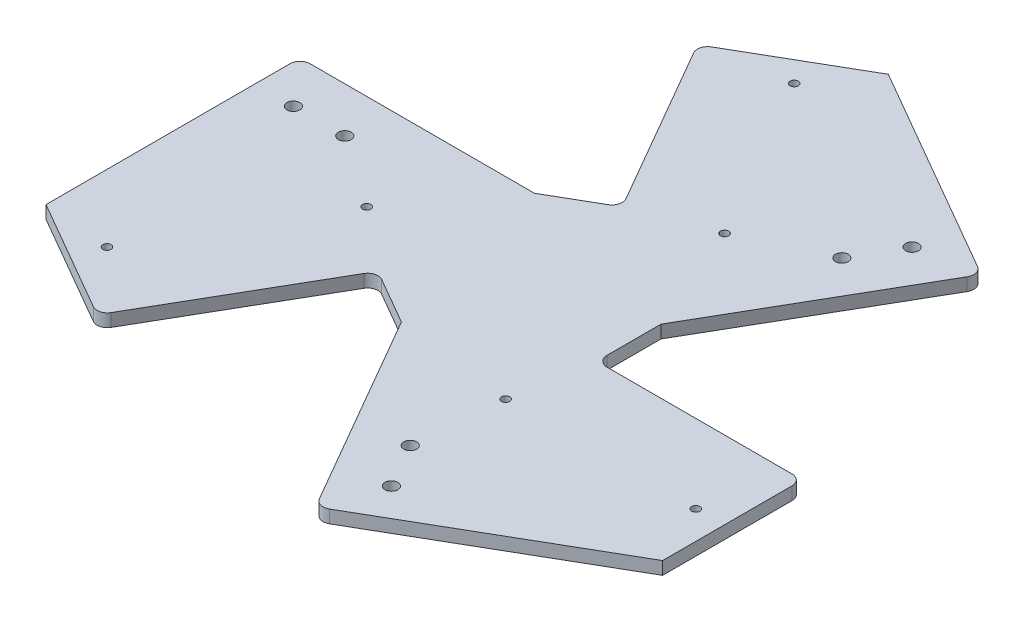
from build123d import *

# Parameters (mm, degrees)
SKETCH1_R           = 1.016
SKETCH1_R_2         = 1.5875
BOSS_EXTRUDE2_DEPTH = 3.175


with BuildPart() as part:
    # Sketch1 → Boss-Extrude2 (new body)
    with BuildSketch(Plane(origin=(0, 0, 0), x_dir=(1, 0, 0), z_dir=(0, 1, 0))):
        with BuildLine():
            Line((76.2, -43.994090512), (24.026831489, -74.116283396))
            ThreePointArc((24.026831489, -74.116283396), (22.099431115, -74.37003047), (20.557126964, -73.186578871))
            Line((20.557126964, -73.186578871), (-7.145746073, -25.203795256))
            Line((-7.145746073, -25.203795256), (-18.694194832, -18.536295256))
            ThreePointArc((-18.694194832, -18.536295256), (-20.621595207, -18.282548183), (-22.163899358, -19.465999782))
            Line((-22.163899358, -19.465999782), (-45.023899358, -59.060681243))
            ThreePointArc((-45.023899358, -59.060681243), (-46.566203509, -60.244132842), (-48.493603884, -59.990385768))
            Line((-48.493603884, -59.990385768), (-76.2, -43.994090512))
            Line((-76.2, -43.994090512), (-76.2, 16.250295256))
            ThreePointArc((-76.2, 16.250295256), (-75.456051224, 18.04634648), (-73.66, 18.790295256))
            Line((-73.66, 18.790295256), (-18.254253927, 18.790295256))
            Line((-18.254253927, 18.790295256), (-6.705805168, 25.457795256))
            ThreePointArc((-6.705805168, 25.457795256), (-5.522353569, 27.000099407), (-5.776100642, 28.927499782))
            Line((-5.776100642, 28.927499782), (-28.636100642, 68.522181243))
            ThreePointArc((-28.636100642, 68.522181243), (-28.889847715, 70.449581617), (-27.706396116, 71.991885768))
            Line((-27.706396116, 71.991885768), (0, 87.988181024))
            Line((0, 87.988181024), (52.173168511, 57.86598814))
            ThreePointArc((52.173168511, 57.86598814), (53.35662011, 56.323683989), (53.102873036, 54.396283615))
            Line((53.102873036, 54.396283615), (25.4, 6.4135))
            Line((25.4, 6.4135), (25.4, -6.9215))
            ThreePointArc((25.4, -6.9215), (26.143948776, -8.717551224), (27.94, -9.4615))
            Line((27.94, -9.4615), (73.66, -9.4615))
            ThreePointArc((73.66, -9.4615), (75.456051224, -10.205448776), (76.2, -12.0015))
            Line((76.2, -12.0015), (76.2, -43.994090512))
        make_face()
        with Locations((69.2404, -28.829)):
            Circle(SKETCH1_R, mode=Mode.SUBTRACT)
        with Locations((-59.586846366, -45.549445368)):
            Circle(SKETCH1_R, mode=Mode.SUBTRACT)
        with Locations((-9.653553634, 74.378445368)):
            Circle(SKETCH1_R, mode=Mode.SUBTRACT)
        with Locations((22.2504, -28.829)):
            Circle(SKETCH1_R, mode=Mode.SUBTRACT)
        with Locations((-36.091846366, -4.854911644)):
            Circle(SKETCH1_R, mode=Mode.SUBTRACT)
        with Locations((13.841446366, 33.683911644)):
            Circle(SKETCH1_R, mode=Mode.SUBTRACT)
        with Locations((26.738386423, -61.552243797)):
            Circle(SKETCH1_R_2, mode=Mode.SUBTRACT)
        with Locations((20.388386423, -50.553721169)):
            Circle(SKETCH1_R_2, mode=Mode.SUBTRACT)
        with Locations((-53.975, 7.62)):
            Circle(SKETCH1_R_2, mode=Mode.SUBTRACT)
        with Locations((-66.675, 7.62)):
            Circle(SKETCH1_R_2, mode=Mode.SUBTRACT)
        with Locations((33.586613577, 42.933721169)):
            Circle(SKETCH1_R_2, mode=Mode.SUBTRACT)
        with Locations((39.936613577, 53.932243797)):
            Circle(SKETCH1_R_2, mode=Mode.SUBTRACT)
    extrude(amount=BOSS_EXTRUDE2_DEPTH)


solid = part.part
